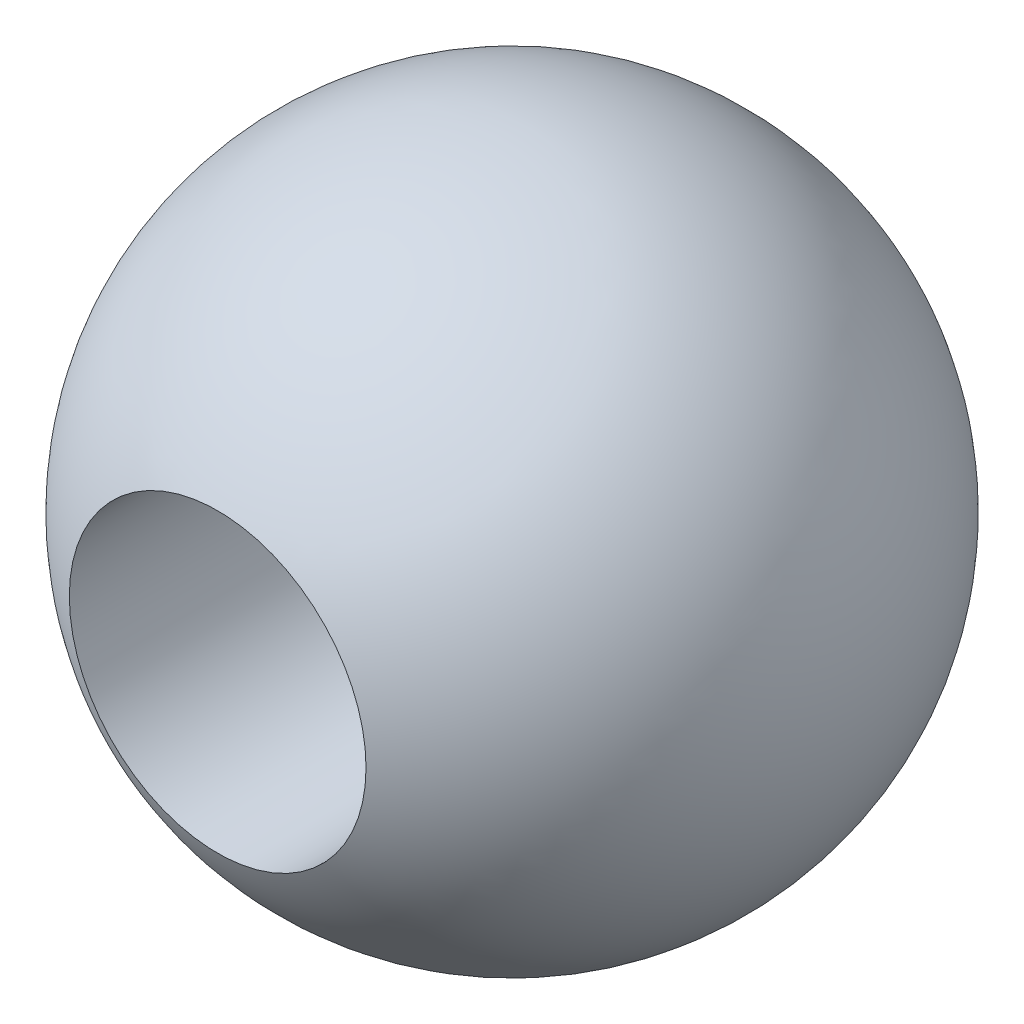
from build123d import *

# Parameters (mm, degrees)
CUT_EXTRUDE1_DEPTH      = 10.621542236
CUT_EXTRUDE1_DEPTH_BACK = 10.621542236
SKETCH3_R               = 2.5


with BuildPart() as part:
    # Sketch2 → Revolve3 (revolve)
    with BuildSketch(Plane.XY):
        with BuildLine():
            Line((0, 5.555), (0, -5.555))
            ThreePointArc((0, -5.555), (-5.555, 0), (0, 5.555))
        make_face()
    revolve(axis=Axis((0, 0, 0), (0, 1, 0)))

    # Sketch3 → Cut-Extrude1 (cut, two sides: drawn at the far end of the back side and taken through both)
    with BuildSketch(Plane.XY.offset(-CUT_EXTRUDE1_DEPTH_BACK)):
        Circle(SKETCH3_R)
    extrude(amount=CUT_EXTRUDE1_DEPTH + CUT_EXTRUDE1_DEPTH_BACK, mode=Mode.SUBTRACT)


solid = part.part
